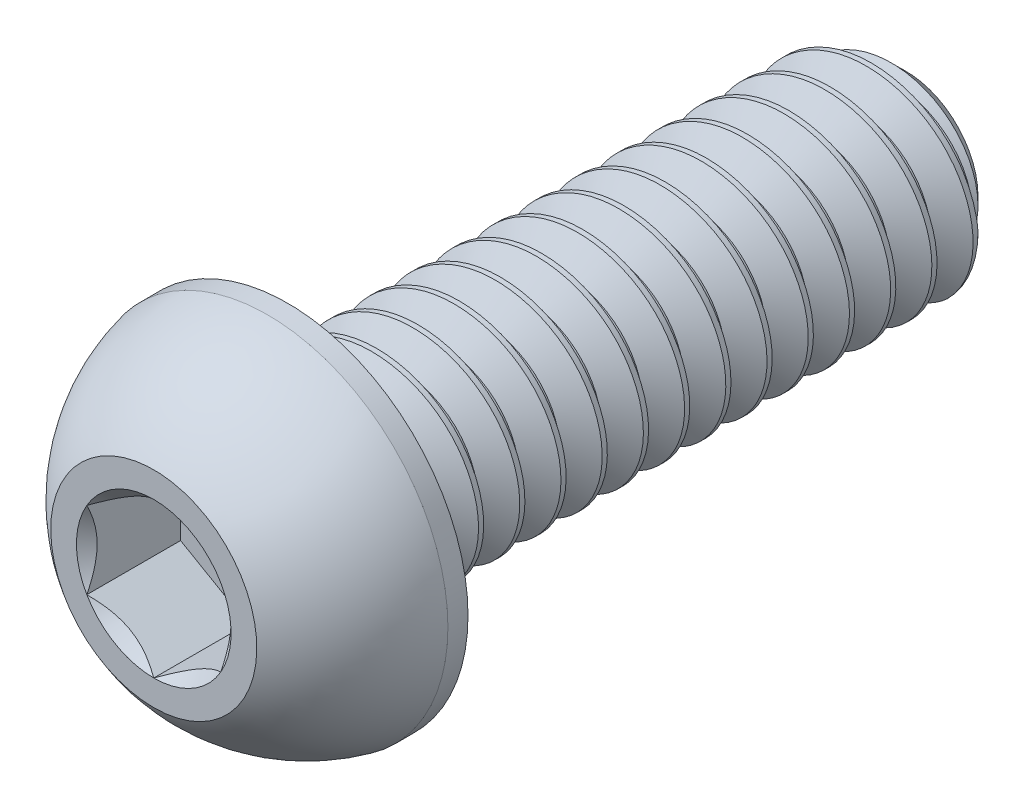
from build123d import *

# Parameters (mm, degrees)
CUT_EXTRUDE2_DEPTH = 0.91
CUT_SWEEP2_PITCH   = 0.4
CUT_SWEEP2_TO      = 6


with BuildPart() as part:
    # Sketch10 → Revolve3 (revolve)
    with BuildSketch(Plane(origin=(0, 0, 0), x_dir=(0, 0, -1), z_dir=(1, 0, 0)), mode=Mode.PRIVATE) as revolve3_sk:
        Polygon((7, 1), (7.3, 0.7), (7.3, 0), (1.3, 0), (1.3, 1), align=None)
    revolve(revolve3_sk.sketch.rotate(Axis((0, 0, 0), (0, 0, -1)), 90), axis=Axis((0, 0, 0), (0, 0, -1)))

    # Sketch7 → Revolve2 (revolve)
    with BuildSketch(Plane(origin=(0, 0, 0), x_dir=(0, 0, -1), z_dir=(1, 0, 0)), mode=Mode.PRIVATE) as revolve2_sk:
        with BuildLine():
            Line((1.105, 1.75), (1.3, 1.75))
            Line((1.3, 1.75), (1.3, 0))
            Line((1.3, 0), (0, 0))
            Line((0, 0), (0, 1))
            ThreePointArc((0, 1), (0.479976957, 1.481850617), (1.105, 1.75))
        make_face()
    revolve(revolve2_sk.sketch.rotate(Axis((0, 0, 0), (0, 0, -1)), 180), axis=Axis((0, 0, 0), (0, 0, -1)))

    # Sketch5 → Cut-Extrude2 (cut)
    with BuildSketch(Plane.XY):
        Polygon((0.65, -0.375277675), (0.65, 0.375277675), (0, 0.75055535), (-0.65, 0.375277675), (-0.65, -0.375277675), (0, -0.75055535), align=None)
    extrude(amount=-CUT_EXTRUDE2_DEPTH, mode=Mode.SUBTRACT)

    # Cut-Extrude3 cone 1 section (through the dimple's axis) → Cut-Extrude3 (revolve, cut)
    with BuildSketch(Plane(origin=(0, 0, 0), x_dir=(0, -1, 0), z_dir=(1, 0, 0))):
        Polygon((0, 0), (0.75055535, 0), (0, 0.75055535), align=None)
    revolve(axis=Axis((0, 0, 0), (0, 0, -1)), mode=Mode.SUBTRACT)


with BuildPart() as body_2:
    # Split1: read off the stored shape, not the designer's step
    # Split1: the piece on the far side of the plane
    add(part.part)
    split(bisect_by=Plane.XY.offset(-1.3), keep=Keep.BOTTOM)

    # Cut-Sweep2: arcs per turn and ends read off the stored shape
    # Cut-Sweep2: the profile of Sketch12 screwed along a right-hand helix through 20 turns, 6 arcs to a turn; built about Z, then put on its axis
    cut_sweep2_z = Axis((0, 0, 0), (0, 0, 1))
    cut_sweep2_corners = [(0.740192379, 0, -0.15), (0.740192379, 0, -0.2), (1.021650635, 0, -0.3625), (1.021650635, 0, 0.0125)]
    with BuildLine(mode=Mode.PRIVATE) as cut_sweep2_profile:
        Line(cut_sweep2_corners[0], cut_sweep2_corners[1])
        Line(cut_sweep2_corners[1], cut_sweep2_corners[2])
        Line(cut_sweep2_corners[2], cut_sweep2_corners[3])
        Line(cut_sweep2_corners[3], cut_sweep2_corners[0])
    cut_sweep2_cap = Face(cut_sweep2_profile.wire())
    cut_sweep2_turn_angles = [0, 30, 60, 90, 120, 150, 180, 210, 240, 270, 300, 330, 360]
    cut_sweep2_turn_weights = [1, 0.8660254037844387, 1, 0.8660254037844387, 1, 0.8660254037844387, 1, 0.8660254037844387, 1, 0.8660254037844387, 1, 0.8660254037844387, 1]
    cut_sweep2_turn_rails = [Edge.make_bspline([Vector(p[0], p[1], 0).rotate(cut_sweep2_z, cut_sweep2_turn_angles[k]) / cut_sweep2_turn_weights[k] + Vector(0, 0, p[2] + CUT_SWEEP2_PITCH * cut_sweep2_turn_angles[k] / 360) for k in range(13)], [0, 0, 0, 1, 1, 2, 2, 3, 3, 4, 4, 5, 5, 6, 6, 6], 2, cut_sweep2_turn_weights) for p in cut_sweep2_corners]
    cut_sweep2_turn_sides = [Face.make_surface_from_curves(cut_sweep2_turn_rails[p[0]], cut_sweep2_turn_rails[p[1]]) for p in [(0, 1), (1, 2), (2, 3), (3, 0)]]
    cut_sweep2 = Plane(origin=(0, 0, -7.3), x_dir=(0, 1, 0), z_dir=(0, 0, 1)) * split(Solid(Shell([*[p.moved(Location((0, 0, CUT_SWEEP2_PITCH * i))) for i in range(20) for p in cut_sweep2_turn_sides], cut_sweep2_cap, cut_sweep2_cap.rotate(cut_sweep2_z, 7200).moved(Location((0, 0, CUT_SWEEP2_PITCH * 7200 / 360)))])), bisect_by=Plane.XY.offset(CUT_SWEEP2_TO), keep=Keep.BOTTOM, mode=Mode.PRIVATE)
    add(cut_sweep2, mode=Mode.SUBTRACT)


with BuildPart() as part_1:
    add(part.part)

    # Split1
    split(bisect_by=Plane.XY.offset(-1.3), keep=Keep.TOP)

    add(body_2.part)  # Boss-Extrude1 merges body 2
    # Boss-Extrude1: read off the stored shape, not the designer's step
    # Boss-Extrude1 outline → Boss-Extrude1 (revolve)
    with BuildSketch(Plane.XZ):
        Polygon((0.740167623, -1.3), (0.740167623, -1.559832377), (1, -1.3), align=None)
    revolve(axis=Axis((0, 0, 0), (0, 0, 1)))


solid = part_1.part
